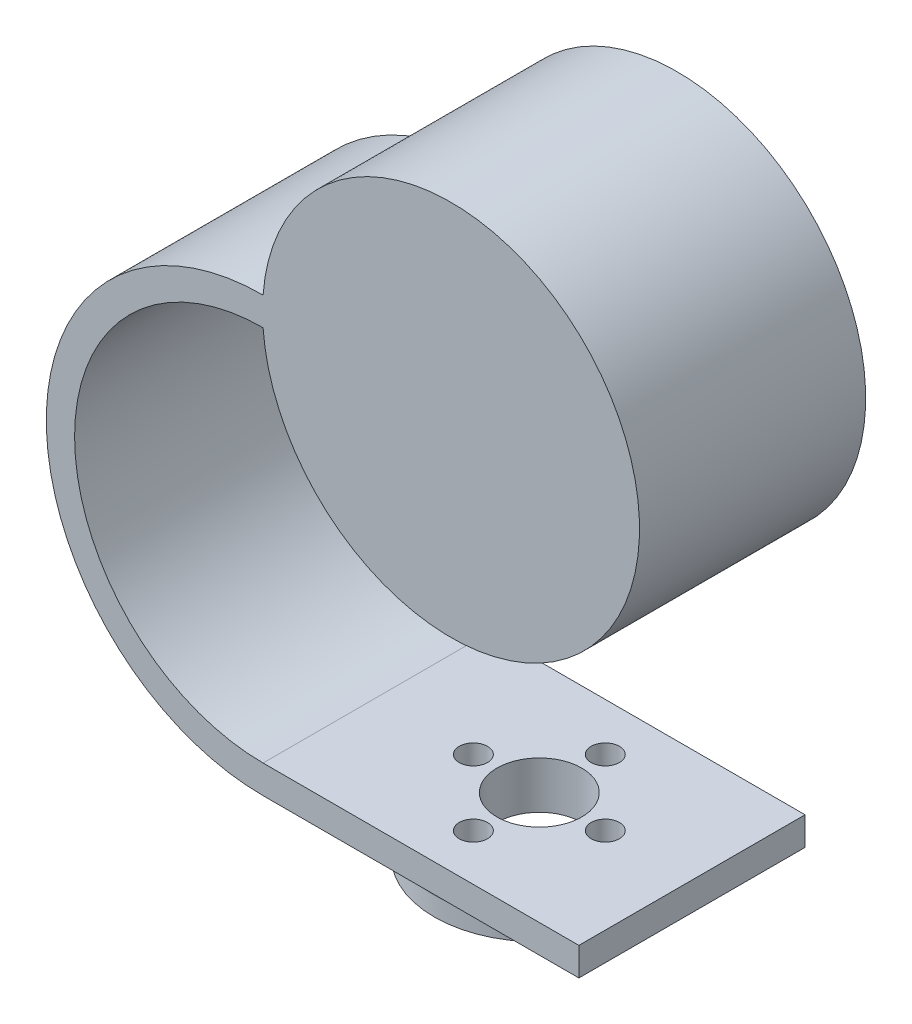
from build123d import *

# Parameters (mm, degrees)
BOSS_EXTRUDE1_DEPTH = 24
SKETCH2_R           = 10
BOSS_EXTRUDE2_DEPTH = 2
SKETCH3_R           = 1.5
SKETCH3_R_2         = 4.5
CUT_EXTRUDE1_DEPTH  = 5
SKETCH6_R           = 10
BOSS_EXTRUDE3_DEPTH = 1
FILLET2_R           = 1
SKETCH7_R           = 1.5
SKETCH7_R_2         = 4.5
CUT_EXTRUDE4_DEPTH  = 10
SKETCH9_R           = 11
SKETCH9_R_2         = 10
BOSS_EXTRUDE4_DEPTH = 3
FILLET3_R           = 1


with BuildPart() as part:
    # Sketch1 → Boss-Extrude1 (new body)
    with BuildSketch(Plane.XY):
        with BuildLine():
            Line((30.263122148, -52.276236142), (30.263122148, -49.276236142))
            Line((30.263122148, -49.276236142), (-3.247333847, -49.276236142))
            ThreePointArc((-3.247333847, -49.276236142), (-23.247333847, -29.276236142), (-3.247333847, -9.276236142))
            ThreePointArc((-3.247333847, -9.276236142), (36.696336828, -7.776236142), (-3.247333847, -6.276236142))
            ThreePointArc((-3.247333847, -6.276236142), (-26.247333847, -29.276236142), (-3.247333847, -52.276236142))
            Line((-3.247333847, -52.276236142), (30.263122148, -52.276236142))
        make_face()
    extrude(amount=BOSS_EXTRUDE1_DEPTH)

    # Sketch2 → Boss-Extrude2 (add)
    with BuildSketch(Plane.XZ.offset(52.276236142)):
        with Locations(Location((14.119877924, 12.054461488, 0), (0, 0, 90))):
            Circle(SKETCH2_R)
    extrude(amount=BOSS_EXTRUDE2_DEPTH)

    # Sketch3 → Cut-Extrude1 (cut)
    with BuildSketch(Plane.XZ.offset(54.276236142)):
        with Locations(Location((14.119877924, 19.054461488, 0), (0, 0, 270))):
            Circle(SKETCH3_R)
        with Locations(Location((21.119877924, 12.054461488, 0), (0, 0, 270))):
            Circle(SKETCH3_R)
        with Locations(Location((14.119877924, 5.054461488, 0), (0, 0, 270))):
            Circle(SKETCH3_R)
        with Locations(Location((7.119877924, 12.054461488, 0), (0, 0, 270))):
            Circle(SKETCH3_R)
        with Locations(Location((14.119877924, 12.054461488, 0), (0, 0, 270))):
            Circle(SKETCH3_R_2)
    extrude(amount=-CUT_EXTRUDE1_DEPTH, mode=Mode.SUBTRACT)

    # Sketch6 → Boss-Extrude3 (add)
    with BuildSketch(Plane(origin=(0, 0, 0), x_dir=(-1, 0, 0), z_dir=(0, 0, -1))):
        with Locations((-17.221710812, -7.598312744)):
            Circle(SKETCH6_R)
    extrude(amount=BOSS_EXTRUDE3_DEPTH)

    # Fillet2
    fillet2_edges = [part.edges().sort_by_distance(p)[0] for p in [
        (27.221710812, -7.598312744, 0),
    ]]
    fillet(fillet2_edges, radius=FILLET2_R - 0.0001)  # a hair under: the kernel refuses the full size

    # Sketch7 → Cut-Extrude4 (cut)
    with BuildSketch(Plane(origin=(0, 0, -1), x_dir=(-1, 0, 0), z_dir=(0, 0, -1))):
        with Locations((-17.221710812, -0.598312744)):
            Circle(SKETCH7_R)
        with Locations((-10.221710812, -7.598312744)):
            Circle(SKETCH7_R)
        with Locations((-17.221710812, -14.598312744)):
            Circle(SKETCH7_R)
        with Locations((-24.221710812, -7.598312744)):
            Circle(SKETCH7_R)
        with Locations((-17.221710812, -7.598312744)):
            Circle(SKETCH7_R_2)
    extrude(amount=-CUT_EXTRUDE4_DEPTH, mode=Mode.SUBTRACT)

    # Sketch9 → Boss-Extrude4 (add)
    with BuildSketch(Plane.XZ.offset(52.276236142)):
        with Locations(Location((13.990564712, 12.070439632, 0), (0, 0, 90))):
            Circle(SKETCH9_R)
        with Locations(Location((13.990564712, 12.070439632, 0), (0, 0, 82.582870782))):
            Circle(SKETCH9_R_2, mode=Mode.SUBTRACT)
    extrude(amount=BOSS_EXTRUDE4_DEPTH)

    # Fillet3
    fillet3_edges = [part.edges().sort_by_distance(p)[0] for p in [
        (13.990564712, -52.276236142, 1.070439632),
    ]]
    fillet(fillet3_edges, radius=FILLET3_R)


solid = part.part
